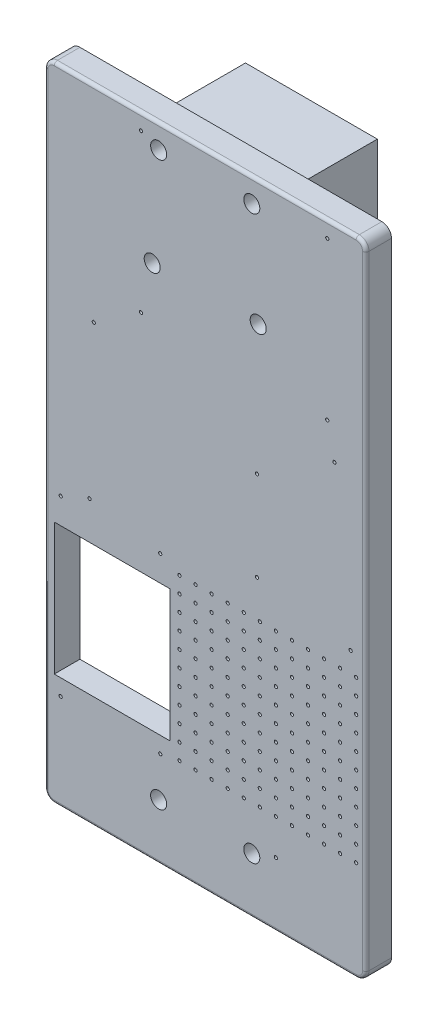
from build123d import *

# Parameters (mm, degrees)
SKETCH1_R           = 2.5
SKETCH1_R_2         = 0.5
SKETCH1_W           = 36
SKETCH1_H           = 41
BOSS_EXTRUDE1_DEPTH = 8
BOSS_EXTRUDE2_START = -23
SKETCH8_W           = 41.060987025
SKETCH8_H           = 39.5
SKETCH8_R           = 2.5
SKETCH8_W_2         = 37
SKETCH8_H_2         = 8
BOSS_EXTRUDE2_DEPTH = 23
SKETCH18_W          = 41.060987025
SKETCH18_H          = 39.5
SKETCH18_R          = 1.5
SKETCH18_W_2        = 37
SKETCH18_H_2        = 8
BOSS_EXTRUDE8_DEPTH = 2
FILLET2_R           = 1
BOSS_EXTRUDE9_DEPTH = 37


with BuildPart() as part:
    # Sketch1 → Boss-Extrude1 (new body)
    with BuildSketch(Plane.XY):
        with BuildLine():
            Line((-47, -13.865466034), (47, -13.865466034))
            ThreePointArc((47, -13.865466034), (49.121320344, -12.986786378), (50, -10.865466034))
            Line((50, -10.865466034), (50, 183.134533966))
            ThreePointArc((50, 183.134533966), (49.121320344, 185.255854309), (47, 186.134533966))
            Line((47, 186.134533966), (-47, 186.134533966))
            ThreePointArc((-47, 186.134533966), (-49.121320344, 185.255854309), (-50, 183.134533966))
            Line((-50, 183.134533966), (-50, -10.865466034))
            ThreePointArc((-50, -10.865466034), (-49.121320344, -12.986786378), (-47, -13.865466034))
        make_face()
        with Locations((-14.5, 3.5)):
            Circle(SKETCH1_R, mode=Mode.SUBTRACT)
        with Locations((-20, 181.134533966)):
            Circle(SKETCH1_R_2, mode=Mode.SUBTRACT)
        with Locations((38, 181.134533966)):
            Circle(SKETCH1_R_2, mode=Mode.SUBTRACT)
        with Locations((-20, 132.134533966)):
            Circle(SKETCH1_R_2, mode=Mode.SUBTRACT)
        with Locations((38, 132.134533966)):
            Circle(SKETCH1_R_2, mode=Mode.SUBTRACT)
        with Locations((14.5, 3.5)):
            Circle(SKETCH1_R, mode=Mode.SUBTRACT)
        with Locations((14.5, 178.681072256)):
            Circle(SKETCH1_R, mode=Mode.SUBTRACT)
        with Locations((-14.5, 178.681072256)):
            Circle(SKETCH1_R, mode=Mode.SUBTRACT)
        with Locations((16.5, 147.181072256)):
            Circle(SKETCH1_R, mode=Mode.SUBTRACT)
        with Locations((-16.5, 147.181072256)):
            Circle(SKETCH1_R, mode=Mode.SUBTRACT)
        with Locations((-34.7, 122.134533966)):
            Circle(SKETCH1_R_2, mode=Mode.SUBTRACT)
        with Locations((40.229522724, 121.867093465)):
            Circle(SKETCH1_R_2, mode=Mode.SUBTRACT)
        with Locations((45.299560119, 73.667093465)):
            Circle(SKETCH1_R_2, mode=Mode.SUBTRACT)
        with Locations((-36, 73.934533966)):
            Circle(SKETCH1_R_2, mode=Mode.SUBTRACT)
        with Locations((-45, 16.134533966)):
            Circle(SKETCH1_R_2, mode=Mode.SUBTRACT)
        with Locations((16.1, 106.667093465)):
            Circle(SKETCH1_R_2, mode=Mode.SUBTRACT)
        with Locations((16.1, 78.767093465)):
            Circle(SKETCH1_R_2, mode=Mode.SUBTRACT)
        with Locations((-14, 16.134533966)):
            Circle(SKETCH1_R_2, mode=Mode.SUBTRACT)
        with Locations((-14, 70.134533966)):
            Circle(SKETCH1_R_2, mode=Mode.SUBTRACT)
        with Locations((-45, 70.134533966)):
            Circle(SKETCH1_R_2, mode=Mode.SUBTRACT)
        with Locations((22, 6.134533966)):
            Circle(SKETCH1_R_2, mode=Mode.SUBTRACT)
        with Locations((47, 67.251900591)):
            Circle(SKETCH1_R_2, mode=Mode.SUBTRACT)
        with Locations((42, 67.251900591)):
            Circle(SKETCH1_R_2, mode=Mode.SUBTRACT)
        with Locations((37, 67.251900591)):
            Circle(SKETCH1_R_2, mode=Mode.SUBTRACT)
        with Locations((32, 67.251900591)):
            Circle(SKETCH1_R_2, mode=Mode.SUBTRACT)
        with Locations((27, 67.251900591)):
            Circle(SKETCH1_R_2, mode=Mode.SUBTRACT)
        with Locations((22, 67.251900591)):
            Circle(SKETCH1_R_2, mode=Mode.SUBTRACT)
        with Locations((17, 67.251900591)):
            Circle(SKETCH1_R_2, mode=Mode.SUBTRACT)
        with Locations((12, 67.251900591)):
            Circle(SKETCH1_R_2, mode=Mode.SUBTRACT)
        with Locations((7, 67.251900591)):
            Circle(SKETCH1_R_2, mode=Mode.SUBTRACT)
        with Locations((2, 67.251900591)):
            Circle(SKETCH1_R_2, mode=Mode.SUBTRACT)
        with Locations((-3, 67.251900591)):
            Circle(SKETCH1_R_2, mode=Mode.SUBTRACT)
        with Locations((-8, 67.251900591)):
            Circle(SKETCH1_R_2, mode=Mode.SUBTRACT)
        with Locations((42, 62.251900591)):
            Circle(SKETCH1_R_2, mode=Mode.SUBTRACT)
        with Locations((37, 62.251900591)):
            Circle(SKETCH1_R_2, mode=Mode.SUBTRACT)
        with Locations((32, 62.251900591)):
            Circle(SKETCH1_R_2, mode=Mode.SUBTRACT)
        with Locations((27, 62.251900591)):
            Circle(SKETCH1_R_2, mode=Mode.SUBTRACT)
        with Locations((22, 62.251900591)):
            Circle(SKETCH1_R_2, mode=Mode.SUBTRACT)
        with Locations((17, 62.251900591)):
            Circle(SKETCH1_R_2, mode=Mode.SUBTRACT)
        with Locations((12, 62.251900591)):
            Circle(SKETCH1_R_2, mode=Mode.SUBTRACT)
        with Locations((7, 62.251900591)):
            Circle(SKETCH1_R_2, mode=Mode.SUBTRACT)
        with Locations((2, 62.251900591)):
            Circle(SKETCH1_R_2, mode=Mode.SUBTRACT)
        with Locations((-3, 62.251900591)):
            Circle(SKETCH1_R_2, mode=Mode.SUBTRACT)
        with Locations((-8, 62.251900591)):
            Circle(SKETCH1_R_2, mode=Mode.SUBTRACT)
        with Locations((42, 57.251900591)):
            Circle(SKETCH1_R_2, mode=Mode.SUBTRACT)
        with Locations((37, 57.251900591)):
            Circle(SKETCH1_R_2, mode=Mode.SUBTRACT)
        with Locations((32, 57.251900591)):
            Circle(SKETCH1_R_2, mode=Mode.SUBTRACT)
        with Locations((27, 57.251900591)):
            Circle(SKETCH1_R_2, mode=Mode.SUBTRACT)
        with Locations((22, 57.251900591)):
            Circle(SKETCH1_R_2, mode=Mode.SUBTRACT)
        with Locations((17, 57.251900591)):
            Circle(SKETCH1_R_2, mode=Mode.SUBTRACT)
        with Locations((12, 57.251900591)):
            Circle(SKETCH1_R_2, mode=Mode.SUBTRACT)
        with Locations((7, 57.251900591)):
            Circle(SKETCH1_R_2, mode=Mode.SUBTRACT)
        with Locations((2, 57.251900591)):
            Circle(SKETCH1_R_2, mode=Mode.SUBTRACT)
        with Locations((-3, 57.251900591)):
            Circle(SKETCH1_R_2, mode=Mode.SUBTRACT)
        with Locations((-8, 57.251900591)):
            Circle(SKETCH1_R_2, mode=Mode.SUBTRACT)
        with Locations((42, 52.251900591)):
            Circle(SKETCH1_R_2, mode=Mode.SUBTRACT)
        with Locations((37, 52.251900591)):
            Circle(SKETCH1_R_2, mode=Mode.SUBTRACT)
        with Locations((32, 52.251900591)):
            Circle(SKETCH1_R_2, mode=Mode.SUBTRACT)
        with Locations((27, 52.251900591)):
            Circle(SKETCH1_R_2, mode=Mode.SUBTRACT)
        with Locations((22, 52.251900591)):
            Circle(SKETCH1_R_2, mode=Mode.SUBTRACT)
        with Locations((17, 52.251900591)):
            Circle(SKETCH1_R_2, mode=Mode.SUBTRACT)
        with Locations((12, 52.251900591)):
            Circle(SKETCH1_R_2, mode=Mode.SUBTRACT)
        with Locations((7, 52.251900591)):
            Circle(SKETCH1_R_2, mode=Mode.SUBTRACT)
        with Locations((2, 52.251900591)):
            Circle(SKETCH1_R_2, mode=Mode.SUBTRACT)
        with Locations((-3, 52.251900591)):
            Circle(SKETCH1_R_2, mode=Mode.SUBTRACT)
        with Locations((-8, 52.251900591)):
            Circle(SKETCH1_R_2, mode=Mode.SUBTRACT)
        with Locations((42, 47.251900591)):
            Circle(SKETCH1_R_2, mode=Mode.SUBTRACT)
        with Locations((37, 47.251900591)):
            Circle(SKETCH1_R_2, mode=Mode.SUBTRACT)
        with Locations((32, 47.251900591)):
            Circle(SKETCH1_R_2, mode=Mode.SUBTRACT)
        with Locations((27, 47.251900591)):
            Circle(SKETCH1_R_2, mode=Mode.SUBTRACT)
        with Locations((22, 47.251900591)):
            Circle(SKETCH1_R_2, mode=Mode.SUBTRACT)
        with Locations((17, 47.251900591)):
            Circle(SKETCH1_R_2, mode=Mode.SUBTRACT)
        with Locations((12, 47.251900591)):
            Circle(SKETCH1_R_2, mode=Mode.SUBTRACT)
        with Locations((7, 47.251900591)):
            Circle(SKETCH1_R_2, mode=Mode.SUBTRACT)
        with Locations((2, 47.251900591)):
            Circle(SKETCH1_R_2, mode=Mode.SUBTRACT)
        with Locations((-3, 47.251900591)):
            Circle(SKETCH1_R_2, mode=Mode.SUBTRACT)
        with Locations((-8, 47.251900591)):
            Circle(SKETCH1_R_2, mode=Mode.SUBTRACT)
        with Locations((42, 42.251900591)):
            Circle(SKETCH1_R_2, mode=Mode.SUBTRACT)
        with Locations((37, 42.251900591)):
            Circle(SKETCH1_R_2, mode=Mode.SUBTRACT)
        with Locations((32, 42.251900591)):
            Circle(SKETCH1_R_2, mode=Mode.SUBTRACT)
        with Locations((27, 42.251900591)):
            Circle(SKETCH1_R_2, mode=Mode.SUBTRACT)
        with Locations((22, 42.251900591)):
            Circle(SKETCH1_R_2, mode=Mode.SUBTRACT)
        with Locations((17, 42.251900591)):
            Circle(SKETCH1_R_2, mode=Mode.SUBTRACT)
        with Locations((12, 42.251900591)):
            Circle(SKETCH1_R_2, mode=Mode.SUBTRACT)
        with Locations((7, 42.251900591)):
            Circle(SKETCH1_R_2, mode=Mode.SUBTRACT)
        with Locations((2, 42.251900591)):
            Circle(SKETCH1_R_2, mode=Mode.SUBTRACT)
        with Locations((-3, 42.251900591)):
            Circle(SKETCH1_R_2, mode=Mode.SUBTRACT)
        with Locations((-8, 42.251900591)):
            Circle(SKETCH1_R_2, mode=Mode.SUBTRACT)
        with Locations((42, 37.251900591)):
            Circle(SKETCH1_R_2, mode=Mode.SUBTRACT)
        with Locations((37, 37.251900591)):
            Circle(SKETCH1_R_2, mode=Mode.SUBTRACT)
        with Locations((32, 37.251900591)):
            Circle(SKETCH1_R_2, mode=Mode.SUBTRACT)
        with Locations((27, 37.251900591)):
            Circle(SKETCH1_R_2, mode=Mode.SUBTRACT)
        with Locations((22, 37.251900591)):
            Circle(SKETCH1_R_2, mode=Mode.SUBTRACT)
        with Locations((17, 37.251900591)):
            Circle(SKETCH1_R_2, mode=Mode.SUBTRACT)
        with Locations((12, 37.251900591)):
            Circle(SKETCH1_R_2, mode=Mode.SUBTRACT)
        with Locations((7, 37.251900591)):
            Circle(SKETCH1_R_2, mode=Mode.SUBTRACT)
        with Locations((2, 37.251900591)):
            Circle(SKETCH1_R_2, mode=Mode.SUBTRACT)
        with Locations((-3, 37.251900591)):
            Circle(SKETCH1_R_2, mode=Mode.SUBTRACT)
        with Locations((-8, 37.251900591)):
            Circle(SKETCH1_R_2, mode=Mode.SUBTRACT)
        with Locations((42, 32.251900591)):
            Circle(SKETCH1_R_2, mode=Mode.SUBTRACT)
        with Locations((37, 32.251900591)):
            Circle(SKETCH1_R_2, mode=Mode.SUBTRACT)
        with Locations((32, 32.251900591)):
            Circle(SKETCH1_R_2, mode=Mode.SUBTRACT)
        with Locations((27, 32.251900591)):
            Circle(SKETCH1_R_2, mode=Mode.SUBTRACT)
        with Locations((22, 32.251900591)):
            Circle(SKETCH1_R_2, mode=Mode.SUBTRACT)
        with Locations((17, 32.251900591)):
            Circle(SKETCH1_R_2, mode=Mode.SUBTRACT)
        with Locations((12, 32.251900591)):
            Circle(SKETCH1_R_2, mode=Mode.SUBTRACT)
        with Locations((7, 32.251900591)):
            Circle(SKETCH1_R_2, mode=Mode.SUBTRACT)
        with Locations((2, 32.251900591)):
            Circle(SKETCH1_R_2, mode=Mode.SUBTRACT)
        with Locations((-3, 32.251900591)):
            Circle(SKETCH1_R_2, mode=Mode.SUBTRACT)
        with Locations((-8, 32.251900591)):
            Circle(SKETCH1_R_2, mode=Mode.SUBTRACT)
        with Locations((42, 27.251900591)):
            Circle(SKETCH1_R_2, mode=Mode.SUBTRACT)
        with Locations((37, 27.251900591)):
            Circle(SKETCH1_R_2, mode=Mode.SUBTRACT)
        with Locations((32, 27.251900591)):
            Circle(SKETCH1_R_2, mode=Mode.SUBTRACT)
        with Locations((27, 27.251900591)):
            Circle(SKETCH1_R_2, mode=Mode.SUBTRACT)
        with Locations((22, 27.251900591)):
            Circle(SKETCH1_R_2, mode=Mode.SUBTRACT)
        with Locations((17, 27.251900591)):
            Circle(SKETCH1_R_2, mode=Mode.SUBTRACT)
        with Locations((12, 27.251900591)):
            Circle(SKETCH1_R_2, mode=Mode.SUBTRACT)
        with Locations((7, 27.251900591)):
            Circle(SKETCH1_R_2, mode=Mode.SUBTRACT)
        with Locations((2, 27.251900591)):
            Circle(SKETCH1_R_2, mode=Mode.SUBTRACT)
        with Locations((-3, 27.251900591)):
            Circle(SKETCH1_R_2, mode=Mode.SUBTRACT)
        with Locations((-8, 27.251900591)):
            Circle(SKETCH1_R_2, mode=Mode.SUBTRACT)
        with Locations((42, 22.251900591)):
            Circle(SKETCH1_R_2, mode=Mode.SUBTRACT)
        with Locations((37, 22.251900591)):
            Circle(SKETCH1_R_2, mode=Mode.SUBTRACT)
        with Locations((32, 22.251900591)):
            Circle(SKETCH1_R_2, mode=Mode.SUBTRACT)
        with Locations((27, 22.251900591)):
            Circle(SKETCH1_R_2, mode=Mode.SUBTRACT)
        with Locations((22, 22.251900591)):
            Circle(SKETCH1_R_2, mode=Mode.SUBTRACT)
        with Locations((17, 22.251900591)):
            Circle(SKETCH1_R_2, mode=Mode.SUBTRACT)
        with Locations((12, 22.251900591)):
            Circle(SKETCH1_R_2, mode=Mode.SUBTRACT)
        with Locations((7, 22.251900591)):
            Circle(SKETCH1_R_2, mode=Mode.SUBTRACT)
        with Locations((2, 22.251900591)):
            Circle(SKETCH1_R_2, mode=Mode.SUBTRACT)
        with Locations((-3, 22.251900591)):
            Circle(SKETCH1_R_2, mode=Mode.SUBTRACT)
        with Locations((-8, 22.251900591)):
            Circle(SKETCH1_R_2, mode=Mode.SUBTRACT)
        with Locations((42, 17.251900591)):
            Circle(SKETCH1_R_2, mode=Mode.SUBTRACT)
        with Locations((37, 17.251900591)):
            Circle(SKETCH1_R_2, mode=Mode.SUBTRACT)
        with Locations((32, 17.251900591)):
            Circle(SKETCH1_R_2, mode=Mode.SUBTRACT)
        with Locations((27, 17.251900591)):
            Circle(SKETCH1_R_2, mode=Mode.SUBTRACT)
        with Locations((22, 17.251900591)):
            Circle(SKETCH1_R_2, mode=Mode.SUBTRACT)
        with Locations((17, 17.251900591)):
            Circle(SKETCH1_R_2, mode=Mode.SUBTRACT)
        with Locations((12, 17.251900591)):
            Circle(SKETCH1_R_2, mode=Mode.SUBTRACT)
        with Locations((7, 17.251900591)):
            Circle(SKETCH1_R_2, mode=Mode.SUBTRACT)
        with Locations((2, 17.251900591)):
            Circle(SKETCH1_R_2, mode=Mode.SUBTRACT)
        with Locations((-3, 17.251900591)):
            Circle(SKETCH1_R_2, mode=Mode.SUBTRACT)
        with Locations((-8, 17.251900591)):
            Circle(SKETCH1_R_2, mode=Mode.SUBTRACT)
        with Locations((47, 62.251900591)):
            Circle(SKETCH1_R_2, mode=Mode.SUBTRACT)
        with Locations((47, 57.251900591)):
            Circle(SKETCH1_R_2, mode=Mode.SUBTRACT)
        with Locations((47, 52.251900591)):
            Circle(SKETCH1_R_2, mode=Mode.SUBTRACT)
        with Locations((47, 47.251900591)):
            Circle(SKETCH1_R_2, mode=Mode.SUBTRACT)
        with Locations((47, 42.251900591)):
            Circle(SKETCH1_R_2, mode=Mode.SUBTRACT)
        with Locations((47, 37.251900591)):
            Circle(SKETCH1_R_2, mode=Mode.SUBTRACT)
        with Locations((47, 32.251900591)):
            Circle(SKETCH1_R_2, mode=Mode.SUBTRACT)
        with Locations((47, 27.251900591)):
            Circle(SKETCH1_R_2, mode=Mode.SUBTRACT)
        with Locations((47, 22.251900591)):
            Circle(SKETCH1_R_2, mode=Mode.SUBTRACT)
        with Locations((47, 17.251900591)):
            Circle(SKETCH1_R_2, mode=Mode.SUBTRACT)
        with Locations((-29, 41.634533966)):
            Rectangle(SKETCH1_W, SKETCH1_H, mode=Mode.SUBTRACT)
    extrude(amount=BOSS_EXTRUDE1_DEPTH)

    # Sketch8 → Boss-Extrude2 (add)
    # profile 1 of 2: a face of its own
    with BuildSketch(Plane.XY.offset(BOSS_EXTRUDE2_START)):
        with Locations((0.066159885, 162.931072256)):
            Rectangle(SKETCH8_W, SKETCH8_H)
        with Locations((-14.5, 178.681072256)):
            Circle(SKETCH8_R, mode=Mode.SUBTRACT)
        with Locations((14.5, 178.681072256)):
            Circle(SKETCH8_R, mode=Mode.SUBTRACT)
        with Locations((16.5, 147.181072256)):
            Circle(SKETCH8_R, mode=Mode.SUBTRACT)
        with Locations((-16.5, 147.181072256)):
            Circle(SKETCH8_R, mode=Mode.SUBTRACT)
    # profile 2 of 2: a face of its own
    with BuildSketch(Plane.XY.offset(BOSS_EXTRUDE2_START)):
        with Locations((0, 3.5)):
            Rectangle(SKETCH8_W_2, SKETCH8_H_2)
        with Locations((-14.5, 3.5)):
            Circle(SKETCH8_R, mode=Mode.SUBTRACT)
        with Locations((14.5, 3.5)):
            Circle(SKETCH8_R, mode=Mode.SUBTRACT)
    extrude(amount=BOSS_EXTRUDE2_DEPTH)

    # Sketch18 → Boss-Extrude8 (add)
    # profile 1 of 2: a face of its own
    with BuildSketch(Plane(origin=(0, 0, -23), x_dir=(-1, 0, 0), z_dir=(0, 0, -1))):
        with Locations((-0.066159885, 162.931072256)):
            Rectangle(SKETCH18_W, SKETCH18_H)
        with Locations((-14.5, 178.681072256)):
            Circle(SKETCH18_R, mode=Mode.SUBTRACT)
        with Locations((14.5, 178.681072256)):
            Circle(SKETCH18_R, mode=Mode.SUBTRACT)
        with Locations((16.5, 147.181072256)):
            Circle(SKETCH18_R, mode=Mode.SUBTRACT)
        with Locations((-16.5, 147.181072256)):
            Circle(SKETCH18_R, mode=Mode.SUBTRACT)
    # profile 2 of 2: a face of its own
    with BuildSketch(Plane(origin=(0, 0, -23), x_dir=(-1, 0, 0), z_dir=(0, 0, -1))):
        with Locations((0, 3.5)):
            Rectangle(SKETCH18_W_2, SKETCH18_H_2)
        with Locations((-14.5, 3.5)):
            Circle(SKETCH18_R, mode=Mode.SUBTRACT)
        with Locations((14.5, 3.5)):
            Circle(SKETCH18_R, mode=Mode.SUBTRACT)
    extrude(amount=BOSS_EXTRUDE8_DEPTH)

    # Fillet2
    fillet2_edges = [part.edges().sort_by_distance(p)[0] for p in [
        (49.121320344, 185.255854309, 8),
        (0, 186.134533966, 8),
        (-49.121320344, 185.255854309, 8),
        (49.121320344, -12.986786378, 8),
        (50, 86.134533966, 8),
        (-50, 86.134533966, 8),
        (-49.121320344, -12.986786378, 8),
        (0, -13.865466034, 8),
    ]]
    fillet(fillet2_edges, radius=FILLET2_R)

    # Sketch20 → Boss-Extrude9 (add)
    with BuildSketch(Plane(origin=(18.5, 7.5, 0), x_dir=(0, 0, 1), z_dir=(-1, 0, 0))):
        Polygon((-25, 0), (0, 0), (0, 7), align=None)
    extrude(amount=BOSS_EXTRUDE9_DEPTH)


solid = part.part
